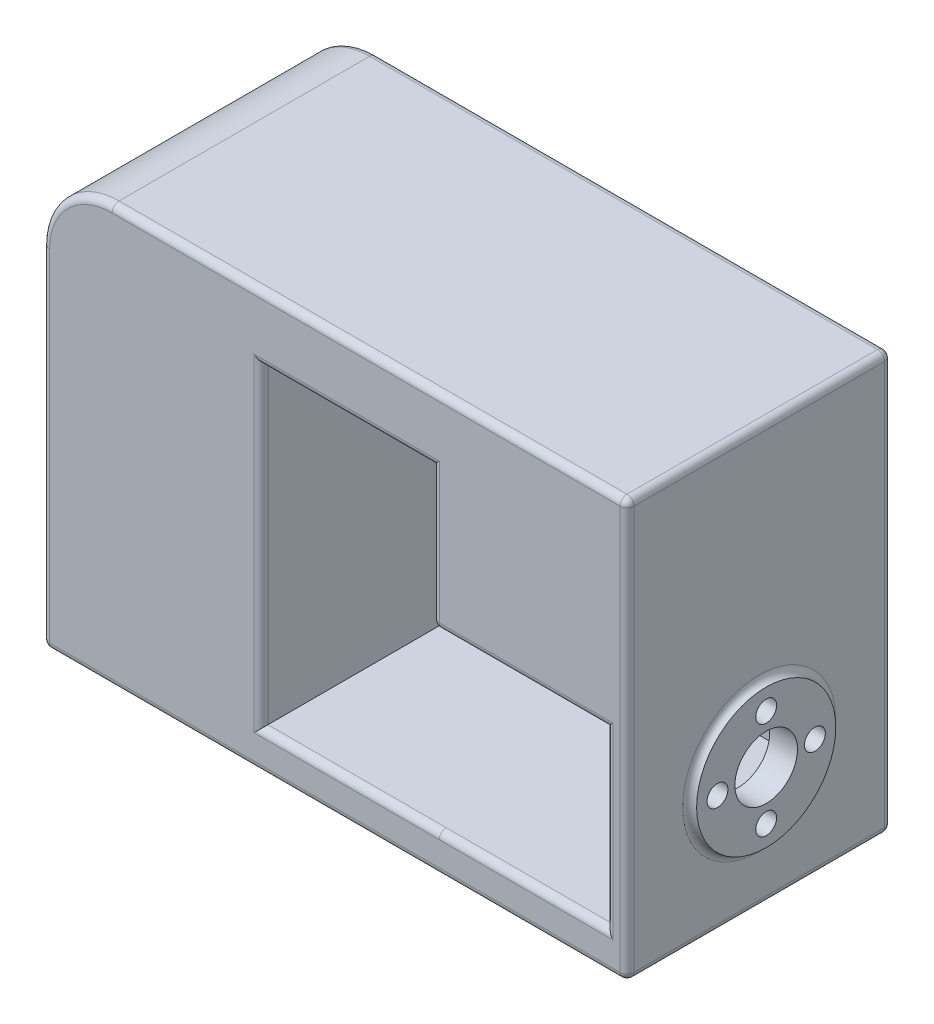
from build123d import *

# Parameters (mm, degrees)
BOSS_EXTRUDE1_DEPTH = 38
SKETCH2_W           = 24.63
SKETCH2_H           = 45.13
CUT_EXTRUDE1_DEPTH  = 35
SKETCH3_W           = 24.63
SKETCH3_H           = 15.13
CUT_EXTRUDE2_DEPTH  = 35
FILLET1_R           = 1
SKETCH4_R           = 10
BOSS_EXTRUDE2_DEPTH = 1
FILLET3_R           = 1
SKETCH5_R           = 1.5
SKETCH5_R_2         = 4.5
CUT_EXTRUDE3_DEPTH  = 21
SKETCH6_W           = 24.981324159
SKETCH6_H           = 25
CUT_EXTRUDE4_DEPTH  = 35
FILLET2_R           = 1
FILLET4_R           = 1


with BuildPart() as part:
    # Sketch1 → Boss-Extrude1 (new body)
    with BuildSketch(Plane.XY):
        with BuildLine():
            Line((-72.469248292, 42.423690205), (1.530751708, 42.423690205))
            Line((1.530751708, 42.423690205), (1.530751708, -17.576309795))
            Line((1.530751708, -17.576309795), (-82.469248292, -17.576309795))
            Line((-82.469248292, -17.576309795), (-82.469248292, 32.423690205))
            ThreePointArc((-82.469248292, 32.423690205), (-79.540316103, 39.494758017), (-72.469248292, 42.423690205))
        make_face()
    extrude(amount=BOSS_EXTRUDE1_DEPTH)

    # Sketch2 → Cut-Extrude1 (cut)
    with BuildSketch(Plane.XY.offset(38)):
        with Locations((-38.765572451, 10.488690205)):
            Rectangle(SKETCH2_W, SKETCH2_H)
    extrude(amount=-CUT_EXTRUDE1_DEPTH, mode=Mode.SUBTRACT)

    # Sketch3 → Cut-Extrude2 (cut)
    with BuildSketch(Plane.XY.offset(3)):
        with Locations((-38.765572451, 10.488690205)):
            Rectangle(SKETCH3_W, SKETCH3_H)
    extrude(amount=-CUT_EXTRUDE2_DEPTH, mode=Mode.SUBTRACT)

    # Fillet1
    fillet1_edges = [part.edges().sort_by_distance(p)[0] for p in [
        (-79.540316103, 39.494758017, 38),
        (-82.469248292, 7.423690205, 38),
        (-51.080572451, 10.488690205, 38),
        (-40.469248292, -17.576309795, 38),
        (-38.765572451, -12.076309795, 38),
        (-26.450572451, 10.488690205, 38),
        (-38.765572451, 33.053690205, 38),
        (-38.765572451, 2.923690205, 0),
        (-26.450572451, 10.488690205, 0),
        (-38.765572451, 18.053690205, 0),
        (-51.080572451, 10.488690205, 0),
        (1.530751708, 12.423690205, 38),
        (-40.469248292, -17.576309795, 0),
        (-82.469248292, 7.423690205, 0),
        (-79.540316103, 39.494758017, 0),
        (-35.469248292, 42.423690205, 0),
        (1.530751708, 12.423690205, 0),
        (-35.469248292, 42.423690205, 38),
        (1.530751708, -17.576309795, 19),
        (-82.469248292, -17.576309795, 19),
        (1.530751708, 42.423690205, 19),
    ]]
    fillet(fillet1_edges, radius=FILLET1_R)

    # Sketch4 → Boss-Extrude2 (add)
    with BuildSketch(Plane(origin=(1.530751708, 0, 0), x_dir=(0, 0, -1), z_dir=(1, 0, 0))):
        with Locations(Location((-19, 0.423690205, 0), (0, 0, 270))):
            Circle(SKETCH4_R)
    extrude(amount=BOSS_EXTRUDE2_DEPTH)

    # Fillet3
    fillet3_edges = [part.edges().sort_by_distance(p)[0] for p in [
        (1.530751708, 10.423690205, 19),
    ]]
    fillet(fillet3_edges, radius=FILLET3_R - 0.0001)  # a hair under: the kernel refuses the full size

    # Sketch5 → Cut-Extrude3 (cut)
    with BuildSketch(Plane(origin=(2.530751708, 0, 0), x_dir=(0, 0, -1), z_dir=(1, 0, 0))):
        with Locations(Location((-19, 7.423690205, 0), (0, 0, 90))):
            Circle(SKETCH5_R)
        with Locations(Location((-12, 0.423690205, 0), (0, 0, 90))):
            Circle(SKETCH5_R)
        with Locations(Location((-19, -6.576309795, 0), (0, 0, 90))):
            Circle(SKETCH5_R)
        with Locations(Location((-26, 0.423690205, 0), (0, 0, 90))):
            Circle(SKETCH5_R)
        with Locations(Location((-19, 0.423690205, 0), (0, 0, 90))):
            Circle(SKETCH5_R_2)
    extrude(amount=-CUT_EXTRUDE3_DEPTH, mode=Mode.SUBTRACT)

    # Sketch6 → Cut-Extrude4 (cut)
    with BuildSketch(Plane.XY.offset(38)):
        with Locations((-13.959910372, 0.423690205)):
            Rectangle(SKETCH6_W, SKETCH6_H)
    extrude(amount=-CUT_EXTRUDE4_DEPTH, mode=Mode.SUBTRACT)

    # Fillet2
    fillet2_edges = [part.edges().sort_by_distance(p)[0] for p in [
        (-38.765572451, 2.923690205, 3),
        (-38.765572451, 18.053690205, 3),
    ]]
    fillet(fillet2_edges, radius=FILLET2_R)

    # Fillet4
    fillet4_edges = [part.edges().sort_by_distance(p)[0] for p in [
        (-26.450572451, 12.923690205, 20),
        (-26.157679232, 12.923690205, 37.707106781),
        (-26.450572451, 7.423690205, 3),
        (-13.459910371, 12.923690205, 38),
        (-13.459910371, -12.076309795, 38),
        (-1.469248292, 0.423690205, 38),
    ]]
    fillet(fillet4_edges, radius=FILLET4_R - 0.0001)  # a hair under: the kernel refuses the full size


solid = part.part
